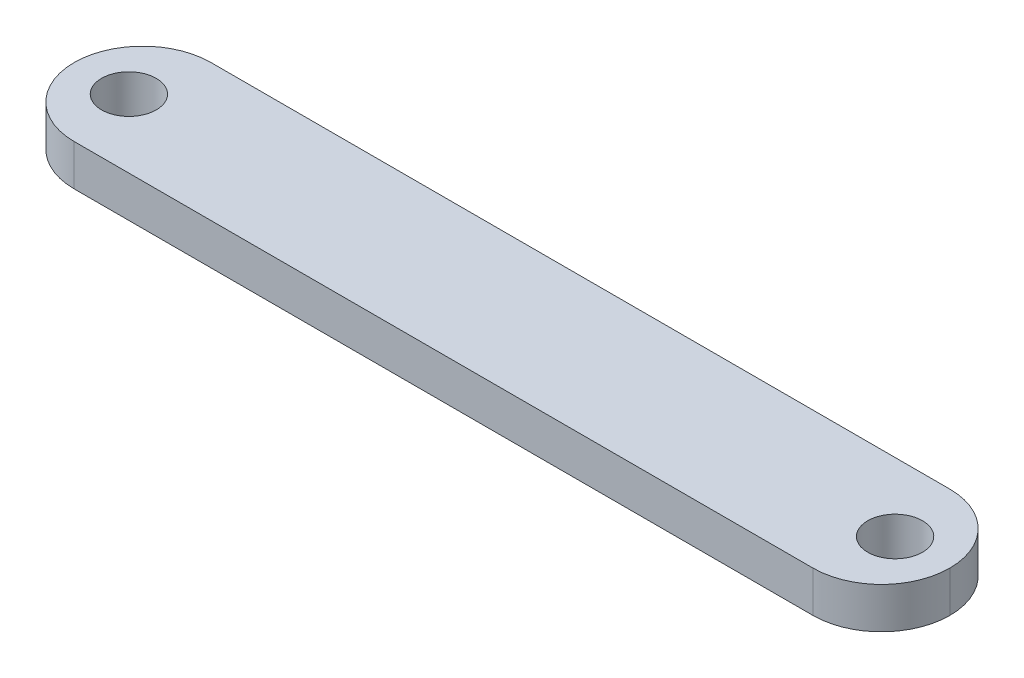
from build123d import *

# Parameters (mm, degrees)
SKETCH1_W           = 203.2
SKETCH1_H           = 31.75
SKETCH1_R           = 6.35
BOSS_EXTRUDE1_DEPTH = 9.525
FILLET1_R           = 15.875


with BuildPart() as part:
    # Sketch1 → Boss-Extrude1 (new body)
    with BuildSketch(Plane(origin=(0, 0, 0), x_dir=(1, 0, 0), z_dir=(0, 1, 0))):
        with Locations((101.6, 15.875)):
            Rectangle(SKETCH1_W, SKETCH1_H)
        with Locations(Location((12.7, 15.875, 0), (0, 0, 90))):
            Circle(SKETCH1_R, mode=Mode.SUBTRACT)
        with Locations(Location((190.5, 15.875, 0), (0, 0, 90))):
            Circle(SKETCH1_R, mode=Mode.SUBTRACT)
    extrude(amount=BOSS_EXTRUDE1_DEPTH)

    # Fillet1
    fillet1_edges = [part.edges().sort_by_distance(p)[0] for p in [
        (203.2, 4.7625, -31.75),
        (203.2, 4.7625, 0),
        (0, 4.7625, -31.75),
        (0, 4.7625, 0),
    ]]
    fillet(fillet1_edges, radius=FILLET1_R - 0.0001)  # a hair under: the kernel refuses the full size


solid = part.part
